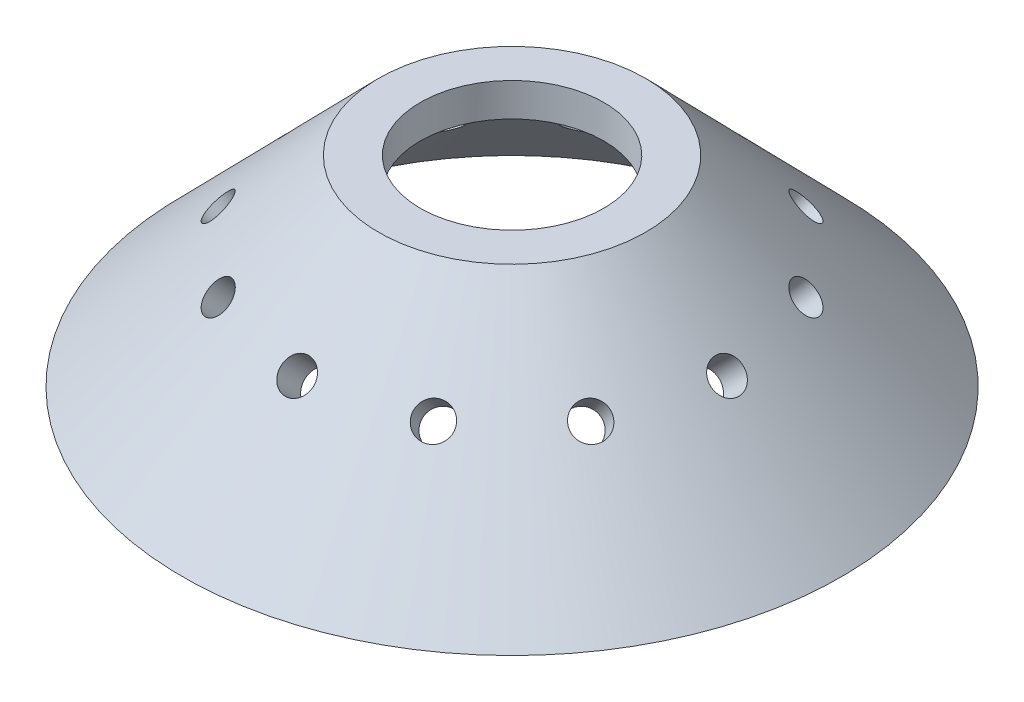
from build123d import *

# Parameters (mm, degrees)
SKETCH11_R         = 13.75
CUT_EXTRUDE1_DEPTH = 77.023089605
SKETCH24_R         = 2.5
CUT_EXTRUDE2_DEPTH = 88.129243823
CIRPATTERN10_COUNT = 12


with BuildPart() as part:
    # Sketch6 → Revolve2 (revolve)
    with BuildSketch(Plane.XY):
        Polygon((49.393876913, -30), (20, 0), (0, 0), (0, -5), (17.898979486, -5), (42.393876913, -30), align=None)
    revolve(axis=Axis((0, -5, 0), (0, 1, 0)))

    # Sketch11 → Cut-Extrude1 (cut, through all)
    with BuildSketch(Plane(origin=(0, 0, 0), x_dir=(1, 0, 0), z_dir=(0, 1, 0))):
        Circle(SKETCH11_R)
    extrude(amount=-CUT_EXTRUDE1_DEPTH, mode=Mode.SUBTRACT)

    # Sketch24 → Cut-Extrude2 (cut, through all)
    with BuildSketch(Plane(origin=(10.204081633, 9.997917317, 0), x_dir=(0, 0, -1), z_dir=(0.714285714285714, 0.6998542122237655, 0))):
        with Locations((0, -31.497084244)):
            Circle(SKETCH24_R)
    cut_extrude2 = extrude(amount=-CUT_EXTRUDE2_DEPTH, mode=Mode.SUBTRACT)

    # CirPattern10: Cut-Extrude2 ×12 about axis
    cirpattern10_axis = Axis((0, -5, 0), (0, -1, 0))
    for i in range(1, CIRPATTERN10_COUNT):
        add(cut_extrude2.rotate(cirpattern10_axis, i * 360 / CIRPATTERN10_COUNT), mode=Mode.SUBTRACT)


solid = part.part
